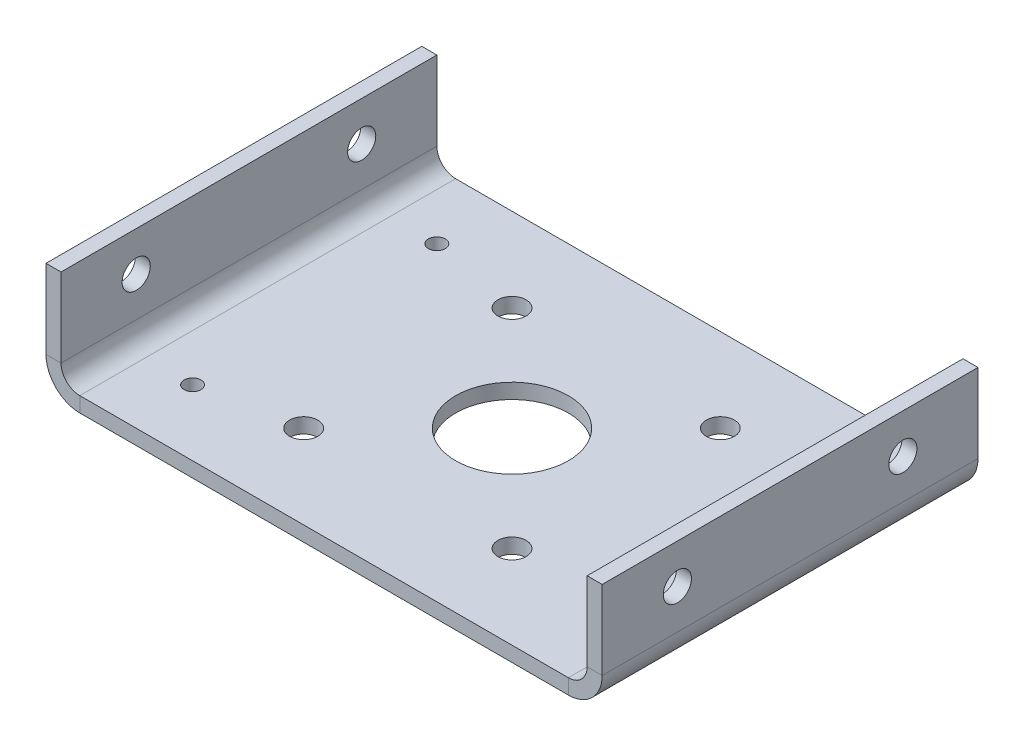
from build123d import *

# Parameters (mm, degrees)
SKETCH1_W                      = 296
SKETCH1_H                      = 200
BASE_FLANGE1_DEPTH             = 8
EDGE_FLANGE1_STRIP_W           = 52
EDGE_FLANGE1_STRIP_H           = 8
EDGE_FLANGE1_STRIP_CUT_DEPTH   = 200
EDGE_FLANGE1_STRIP_2_W         = 52
EDGE_FLANGE1_STRIP_2_H         = 8
EDGE_FLANGE1_STRIP_CUT_2_DEPTH = 200
EDGE_FLANGE1_DEPTH             = 200
EDGE_FLANGE1_BEND_DEPTH        = 200
SKETCH12_R                     = 30
CUT_EXTRUDE1_DEPTH             = 10
SKETCH13_R                     = 7.5
CUT_EXTRUDE2_DEPTH             = 10
SKETCH15_R                     = 7.5
CUT_EXTRUDE3_DEPTH             = 317.733326317
SKETCH16_R                     = 4.5
CUT_EXTRUDE4_DEPTH             = 10
MIRROR5_COPY_1_SKETCH_R        = 7.5
MIRROR5_COPY_1_DEPTH           = 10


# Sheet-metal steps are written as plain solids
with BuildPart() as part:
    # Sketch1 → Base-Flange1 (new body)
    with BuildSketch(Plane(origin=(0, 0, 0), x_dir=(1, 0, 0), z_dir=(0, 1, 0))):
        Rectangle(SKETCH1_W, SKETCH1_H)
    extrude(amount=-BASE_FLANGE1_DEPTH)

    # Edge-Flange1 strip (across the edge) → Edge-Flange1 strip cut (cut)
    with BuildSketch(Plane(origin=(-148, 0, -100), x_dir=(1, 0, 0), z_dir=(0, 0, 1))):
        with Locations((-8, -4)):
            Rectangle(EDGE_FLANGE1_STRIP_W, EDGE_FLANGE1_STRIP_H)
    extrude(amount=EDGE_FLANGE1_STRIP_CUT_DEPTH, mode=Mode.SUBTRACT)

    # Edge-Flange1 strip 2 (across the edge) → Edge-Flange1 strip cut 2 (cut)
    with BuildSketch(Plane(origin=(148, 0, 100), x_dir=(-1, 0, 0), z_dir=(0, 0, -1))):
        with Locations((-8, -4)):
            Rectangle(EDGE_FLANGE1_STRIP_2_W, EDGE_FLANGE1_STRIP_2_H)
    extrude(amount=EDGE_FLANGE1_STRIP_CUT_2_DEPTH, mode=Mode.SUBTRACT)

    # Edge-Flange1 section (across the edge) → Edge-Flange1 (add)
    with BuildSketch(Plane(origin=(-148, 0, -100), x_dir=(1, 0, 0), z_dir=(0, 0, 1))):
        with BuildLine():
            Line((0, 10), (0, 52))
            Line((0, 52), (8, 52))
            Line((8, 52), (8, 10))
            ThreePointArc((8, 10), (10.928932188, 2.928932188), (18, 0))
            Line((18, 0), (18, -8))
            ThreePointArc((18, -8), (5.272077939, -2.727922061), (0, 10))
        make_face()
    extrude(amount=EDGE_FLANGE1_DEPTH)

    # Edge-Flange1 section 2 (across the edge) → Edge-Flange1 bend (add)
    with BuildSketch(Plane(origin=(148, 0, 100), x_dir=(-1, 0, 0), z_dir=(0, 0, -1))):
        with BuildLine():
            Line((0, 10), (0, 52))
            Line((0, 52), (8, 52))
            Line((8, 52), (8, 10))
            ThreePointArc((8, 10), (10.928932188, 2.928932188), (18, 0))
            Line((18, 0), (18, -8))
            ThreePointArc((18, -8), (5.272077939, -2.727922061), (0, 10))
        make_face()
    extrude(amount=EDGE_FLANGE1_BEND_DEPTH)

    # Sketch12 → Cut-Extrude1 (cut)
    with BuildSketch(Plane(origin=(0, -8, 0), x_dir=(-1, 0, 0), z_dir=(0, -1, 0))):
        with Locations(Location((0, 0, 0), (0, 0, 90))):
            Circle(SKETCH12_R)
    extrude(amount=-CUT_EXTRUDE1_DEPTH, mode=Mode.SUBTRACT)

    # Sketch13 → Cut-Extrude2 (cut)
    with BuildSketch(Plane(origin=(0, -8, 0), x_dir=(-1, 0, 0), z_dir=(0, -1, 0))):
        with Locations(Location((55.437171645, -55.437171645, 0), (0, 0, 90))):
            Circle(SKETCH13_R)
    cut_extrude2 = extrude(amount=-CUT_EXTRUDE2_DEPTH, mode=Mode.SUBTRACT)

    # Mirror4: Cut-Extrude2 across plane
    add(cut_extrude2.mirror(Plane(origin=(0, 0, 0), x_dir=(0, 0, 1), z_dir=(1, 0, 0))), mode=Mode.SUBTRACT)

    # Sketch15 → Cut-Extrude3 (cut, through all)
    with BuildSketch(Plane.ZY.offset(148)):
        with Locations(Location((-60, 31, 0), (0, 0, 270))):
            Circle(SKETCH15_R)
    cut_extrude3 = extrude(amount=-CUT_EXTRUDE3_DEPTH, mode=Mode.SUBTRACT)

    # Sketch16 → Cut-Extrude4 (cut)
    with BuildSketch(Plane(origin=(0, -8, 0), x_dir=(-1, 0, 0), z_dir=(0, -1, 0))):
        with Locations(Location((105, 65, 0), (0, 0, 90))):
            Circle(SKETCH16_R)
    cut_extrude4 = extrude(amount=-CUT_EXTRUDE4_DEPTH, mode=Mode.SUBTRACT)

    # Mirror5: Cut-Extrude2, Cut-Extrude3, Cut-Extrude4 across plane
    add(cut_extrude2.mirror(Plane.XY), mode=Mode.SUBTRACT)
    add(cut_extrude3.mirror(Plane.XY), mode=Mode.SUBTRACT)
    add(cut_extrude4.mirror(Plane.XY), mode=Mode.SUBTRACT)

    # Mirror5 copy 1 sketch → Mirror5 copy 1 (cut)
    with BuildSketch(Plane.XZ.offset(8)):
        with Locations(Location((55.437171645, -55.437171645, 0), (0, 0, 90))):
            Circle(MIRROR5_COPY_1_SKETCH_R)
    extrude(amount=-MIRROR5_COPY_1_DEPTH, mode=Mode.SUBTRACT)


solid = part.part
